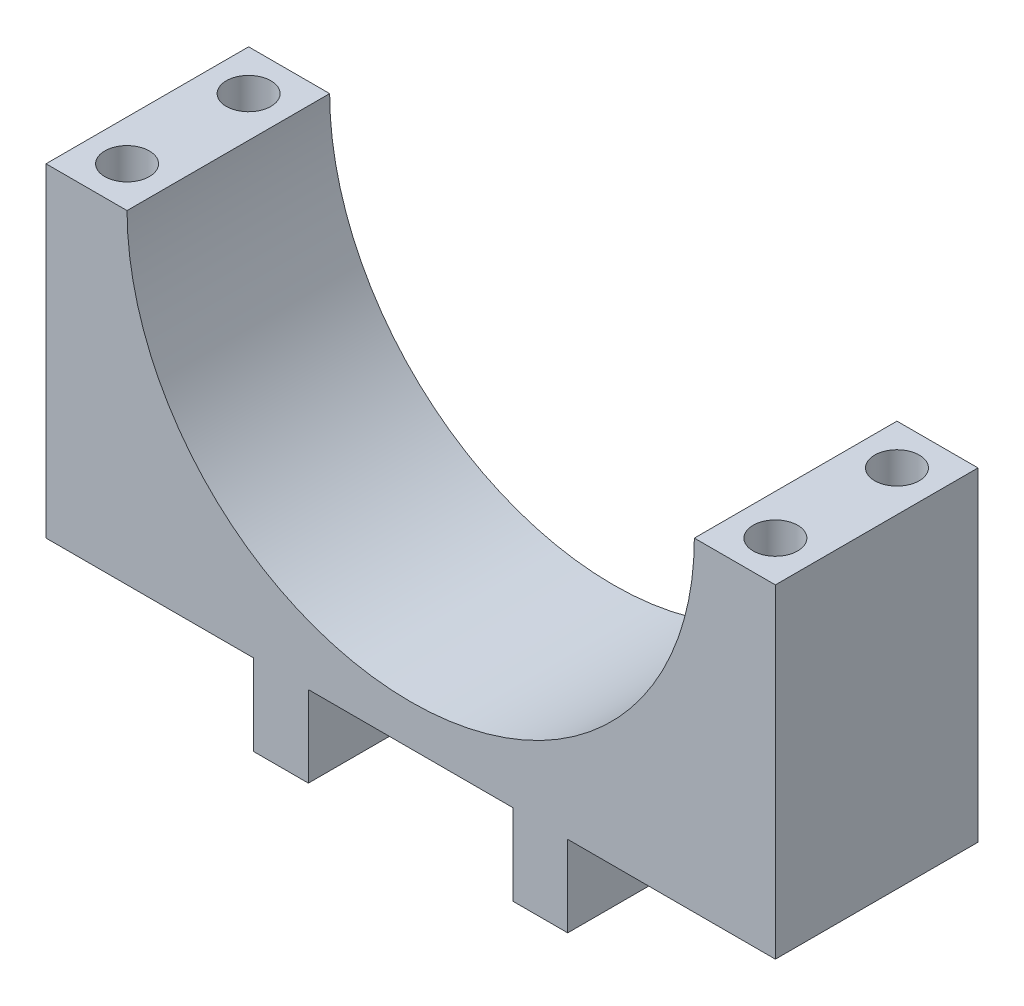
from build123d import *

# Parameters (mm, degrees)
DODANIE_WYCI_GNI_CIE1_DEPTH = 50
SZKIC2_R                    = 5.5
WYTNIJ_WYCI_GNI_CIE1_DEPTH  = 21


with BuildPart() as part:
    # Szkic1 → Dodanie-wyciągnięcie1 (new body)
    with BuildSketch(Plane.XY):
        with BuildLine():
            Line((70, 0), (90, 0))
            Line((90, 0), (90, -80))
            Line((90, -80), (38.75, -80))
            Line((38.75, -80), (38.75, -100))
            Line((38.75, -100), (25.25, -100))
            Line((25.25, -100), (25.25, -80))
            Line((25.25, -80), (-25.25, -80))
            Line((-25.25, -80), (-25.25, -100))
            Line((-25.25, -100), (-38.75, -100))
            Line((-38.75, -100), (-38.75, -80))
            Line((-38.75, -80), (-90, -80))
            Line((-90, -80), (-90, 0))
            Line((-90, 0), (-70, 0))
            ThreePointArc((-70, 0), (0, -70), (70, 0))
        make_face()
    extrude(amount=DODANIE_WYCI_GNI_CIE1_DEPTH)

    # Szkic2 → Wytnij-wyciągnięcie1 (cut)
    with BuildSketch(Plane(origin=(0, 0, 0), x_dir=(1, 0, 0), z_dir=(0, 1, 0))):
        with Locations((-80, -10)):
            Circle(SZKIC2_R)
        with Locations((-80, -40)):
            Circle(SZKIC2_R)
    wytnij_wyci_gni_cie1 = extrude(amount=-WYTNIJ_WYCI_GNI_CIE1_DEPTH, mode=Mode.SUBTRACT)

    # Lustro1: Wytnij-wyciągnięcie1 across plane
    add(wytnij_wyci_gni_cie1.mirror(Plane(origin=(0, 0, 0), x_dir=(0, 0, 1), z_dir=(1, 0, 0))), mode=Mode.SUBTRACT)


solid = part.part
